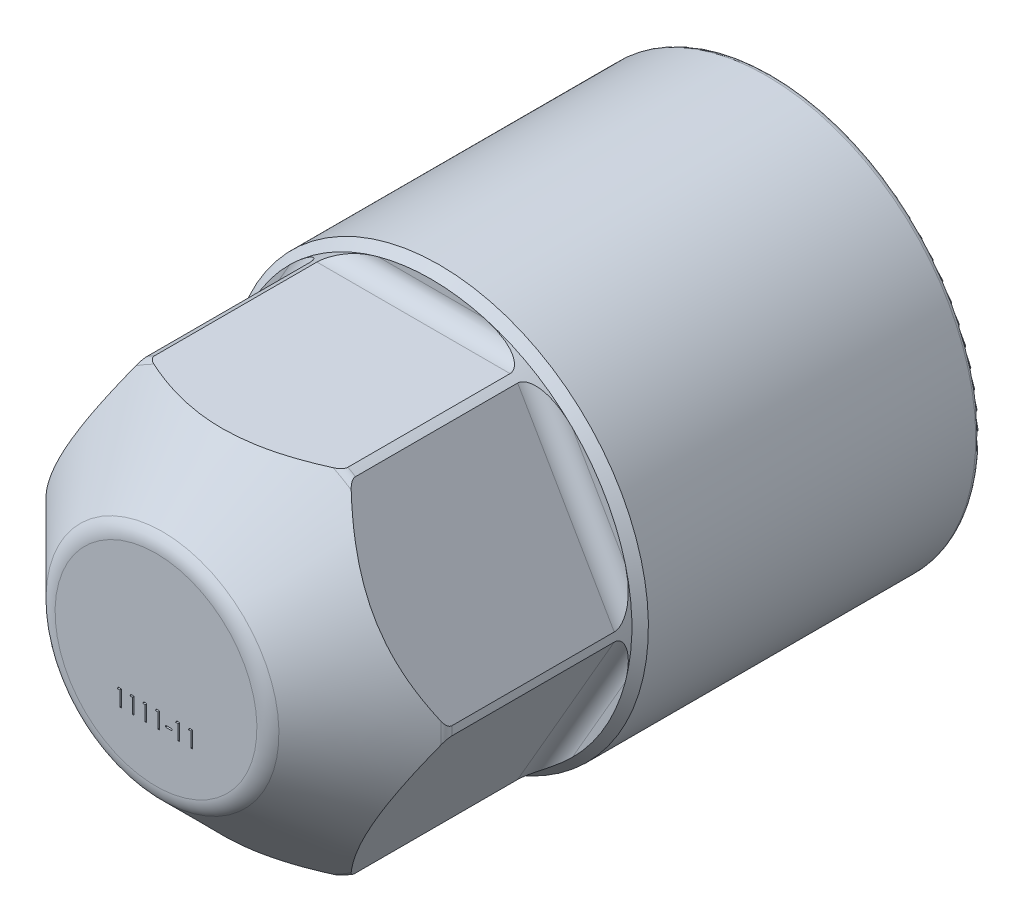
from build123d import *

# Parameters (mm, degrees)
SKETCH2_R          = 26.769230912
CUT_EXTRUDE1_DEPTH = 25
SKETCH3_W          = 0.576923077
SKETCH3_H          = 0.153846154
CUT_EXTRUDE2_DEPTH = 0.25
FILLET1_R          = 1.6


with BuildPart() as part:
    # Sketch1 → Revolve1 (revolve)
    with BuildSketch(Plane(origin=(0, 0, 0), x_dir=(0, 0, -1), z_dir=(1, 0, 0))):
        with BuildLine():
            Line((0, 10.75), (0, 18.5))
            ThreePointArc((0, 18.5), (-0.146446609, 18.853553391), (-0.5, 19))
            Line((-0.5, 19), (-30.25, 19))
            Line((-30.25, 19), (-31, 18.25))
            Line((-31, 18.25), (-47.335786438, 18.25))
            ThreePointArc((-47.335786438, 18.25), (-47.71846987, 18.173879533), (-48.042893219, 17.957106781))
            Line((-48.042893219, 17.957106781), (-55.414213562, 10.585786438))
            ThreePointArc((-55.414213562, 10.585786438), (-55.847759065, 9.93693974), (-56, 9.171572875))
            Line((-56, 9.171572875), (-56, 0))
            Line((-56, 0), (-51.275732108, 0))
            Line((-51.275732108, 0), (-48, 9))
            Line((-48, 9), (-6.25, 9))
            Line((-6.25, 9), (-5, 10.25))
            Line((-5, 10.25), (-0.5, 10.25))
            Line((-0.5, 10.25), (0, 10.75))
        make_face()
    revolve(axis=Axis((0, 0, 0), (0, 0, 1)))

    # Sketch2 → Cut-Extrude1 (cut)
    with BuildSketch(Plane.XY.offset(31)):
        Circle(SKETCH2_R)
        Polygon((-18.475208614, 0), (-9.237604307, -16), (9.237604307, -16), (18.475208614, 0), (9.237604307, 16), (-9.237604307, 16), align=None, mode=Mode.SUBTRACT)
    extrude(amount=CUT_EXTRUDE1_DEPTH, mode=Mode.SUBTRACT)

    # Sketch3 → Cut-Extrude2 (cut)
    with BuildSketch(Plane.XY.offset(56)):
        Polygon((-3.431189904, -3.079599435), (-3.153846154, -3.079599435), (-3.153846154, -4.579599435), (-3.288461538, -4.579599435), (-3.288461538, -3.233445588), (-3.519230769, -3.233445588), align=None)
        Polygon((-2.27734375, -3.079599435), (-2, -3.079599435), (-2, -4.579599435), (-2.134615385, -4.579599435), (-2.134615385, -3.233445588), (-2.365384615, -3.233445588), align=None)
        Polygon((-1.123497596, -3.079599435), (-0.846153846, -3.079599435), (-0.846153846, -4.579599435), (-0.980769231, -4.579599435), (-0.980769231, -3.233445588), (-1.211538462, -3.233445588), align=None)
        Polygon((0.030348558, -3.079599435), (0.307692308, -3.079599435), (0.307692308, -4.579599435), (0.173076923, -4.579599435), (0.173076923, -3.233445588), (-0.057692308, -3.233445588), align=None)
        with Locations((1.153846154, -4.002676358)):
            Rectangle(SKETCH3_W, SKETCH3_H)
        Polygon((1.876502404, -3.079599435), (2.153846154, -3.079599435), (2.153846154, -4.579599435), (2.019230769, -4.579599435), (2.019230769, -3.233445588), (1.788461538, -3.233445588), align=None)
        Polygon((3.030348558, -3.079599435), (3.307692308, -3.079599435), (3.307692308, -4.579599435), (3.173076923, -4.579599435), (3.173076923, -3.233445588), (2.942307692, -3.233445588), align=None)
    extrude(amount=-CUT_EXTRUDE2_DEPTH, mode=Mode.SUBTRACT)

    # Fillet1
    # the kernel refuses this fillet: 1.6 mm, written as the material it adds along each edge
    with BuildSketch(Plane(origin=(7.467143994, -19.066527215, 31), x_dir=(0.8660254037844389, -0.4999999999999996, 0), z_dir=(0.4999999999999996, 0.8660254037844389, 0))) as fillet1_piece_1_section:
        with BuildLine():
            CenterArc((FILLET1_R, -FILLET1_R), FILLET1_R, 90, 90)
            Line((0, -FILLET1_R), (0, 0))
            Line((0, 0), (FILLET1_R, 0))
        make_face()
    fillet1_piece_1 = extrude(amount=25.557049866, mode=Mode.PRIVATE)
    fillet1_piece_1 = fillet1_piece_1 & Plane(origin=(0, 0, 31.611072615), x_dir=(0, 1, 0), z_dir=(0, 0, 1)) * Cylinder(18.25, 58, mode=Mode.PRIVATE)
    add(fillet1_piece_1)
    with BuildSketch(Plane(origin=(-12.778524933, -16, 31), x_dir=(0, -1, 0), z_dir=(1, 0, 0))) as fillet1_piece_2_section:
        with BuildLine():
            CenterArc((FILLET1_R, -FILLET1_R), FILLET1_R, 90, 90)
            Line((0, -FILLET1_R), (0, 0))
            Line((0, 0), (FILLET1_R, 0))
        make_face()
    fillet1_piece_2 = extrude(amount=25.557049866, mode=Mode.PRIVATE)
    fillet1_piece_2 = fillet1_piece_2 & Plane(origin=(0, 0, 31.611072034), x_dir=(0, 1, 0), z_dir=(0, 0, 1)) * Cylinder(18.25, 58, mode=Mode.PRIVATE)
    add(fillet1_piece_2)
    with BuildSketch(Plane(origin=(-20.245668927, 3.066527215, 31), x_dir=(-0.8660254037844386, -0.5000000000000001, 0), z_dir=(0.5000000000000001, -0.8660254037844386, 0))) as fillet1_piece_3_section:
        with BuildLine():
            CenterArc((FILLET1_R, -FILLET1_R), FILLET1_R, 90, 90)
            Line((0, -FILLET1_R), (0, 0))
            Line((0, 0), (FILLET1_R, 0))
        make_face()
    fillet1_piece_3 = extrude(amount=25.557049866, mode=Mode.PRIVATE)
    fillet1_piece_3 = fillet1_piece_3 & Plane(origin=(0, 0, 31.611072034), x_dir=(0, 1, 0), z_dir=(0, 0, 1)) * Cylinder(18.25, 58, mode=Mode.PRIVATE)
    add(fillet1_piece_3)
    with BuildSketch(Plane(origin=(-7.467143994, 19.066527215, 31), x_dir=(-0.8660254037844387, 0.49999999999999994, 0), z_dir=(-0.4999999999999999, -0.8660254037844388, 0))) as fillet1_piece_4_section:
        with BuildLine():
            CenterArc((FILLET1_R, -FILLET1_R), FILLET1_R, 90, 90)
            Line((0, -FILLET1_R), (0, 0))
            Line((0, 0), (FILLET1_R, 0))
        make_face()
    fillet1_piece_4 = extrude(amount=25.557049866, mode=Mode.PRIVATE)
    fillet1_piece_4 = fillet1_piece_4 & Plane(origin=(0, 0, 31.611072034), x_dir=(0, 1, 0), z_dir=(0, 0, 1)) * Cylinder(18.25, 58, mode=Mode.PRIVATE)
    add(fillet1_piece_4)
    with BuildSketch(Plane(origin=(12.778524933, 16, 31), x_dir=(0, 1, 0), z_dir=(-1, 0, 0))) as fillet1_piece_5_section:
        with BuildLine():
            CenterArc((FILLET1_R, -FILLET1_R), FILLET1_R, 90, 90)
            Line((0, -FILLET1_R), (0, 0))
            Line((0, 0), (FILLET1_R, 0))
        make_face()
    fillet1_piece_5 = extrude(amount=25.557049866, mode=Mode.PRIVATE)
    fillet1_piece_5 = fillet1_piece_5 & Plane(origin=(0, 0, 31.611071893), x_dir=(0, 1, 0), z_dir=(0, 0, 1)) * Cylinder(18.25, 58, mode=Mode.PRIVATE)
    add(fillet1_piece_5)
    with BuildSketch(Plane(origin=(20.245668927, -3.066527215, 31), x_dir=(0.8660254037844384, 0.5000000000000004, 0), z_dir=(-0.5000000000000004, 0.8660254037844385, 0))) as fillet1_piece_6_section:
        with BuildLine():
            CenterArc((FILLET1_R, -FILLET1_R), FILLET1_R, 90, 90)
            Line((0, -FILLET1_R), (0, 0))
            Line((0, 0), (FILLET1_R, 0))
        make_face()
    fillet1_piece_6 = extrude(amount=25.557049866, mode=Mode.PRIVATE)
    fillet1_piece_6 = fillet1_piece_6 & Plane(origin=(0, 0, 31.611071893), x_dir=(0, 1, 0), z_dir=(0, 0, 1)) * Cylinder(18.25, 58, mode=Mode.PRIVATE)
    add(fillet1_piece_6)


solid = part.part
